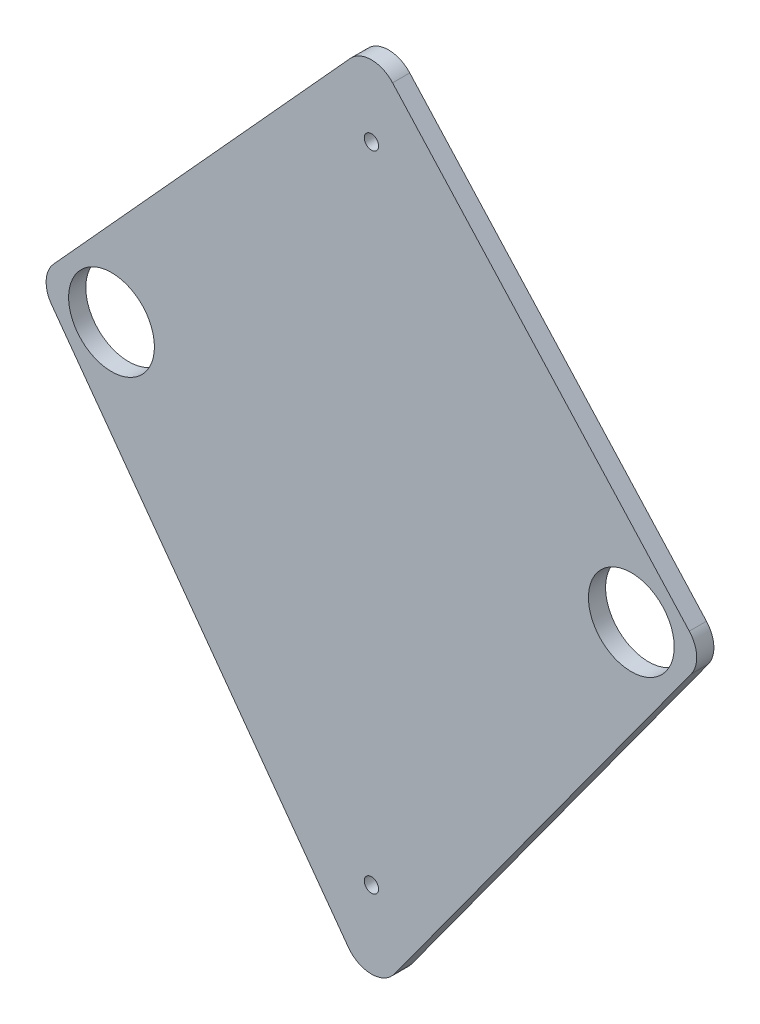
from build123d import *

# Parameters (mm, degrees)
SKETCH1_R           = 15
SKETCH1_R_2         = 2.5
BOSS_EXTRUDE1_DEPTH = 6
FILLET1_R           = 10


with BuildPart() as part:
    # Sketch1 → Boss-Extrude1 (new body)
    with BuildSketch(Plane.XY):
        Polygon((0, 129.737348718), (-116.628583892, 1.404840033), (0, -159.010795822), (116.628583892, 1.404840033), align=None)
        with Locations((-90.88, 0)):
            Circle(SKETCH1_R, mode=Mode.SUBTRACT)
        with Locations((90.88, 0)):
            Circle(SKETCH1_R, mode=Mode.SUBTRACT)
        with Locations((0, -125)):
            Circle(SKETCH1_R_2, mode=Mode.SUBTRACT)
        with Locations((0, 100)):
            Circle(SKETCH1_R_2, mode=Mode.SUBTRACT)
    extrude(amount=BOSS_EXTRUDE1_DEPTH)

    # Fillet1
    fillet1_edges = [part.edges().sort_by_distance(p)[0] for p in [
        (0, -159.010795822, 3),
        (116.628583892, 1.404840033, 3),
        (0, 129.737348718, 3),
        (-116.628583892, 1.404840033, 3),
    ]]
    fillet(fillet1_edges, radius=FILLET1_R)


solid = part.part
